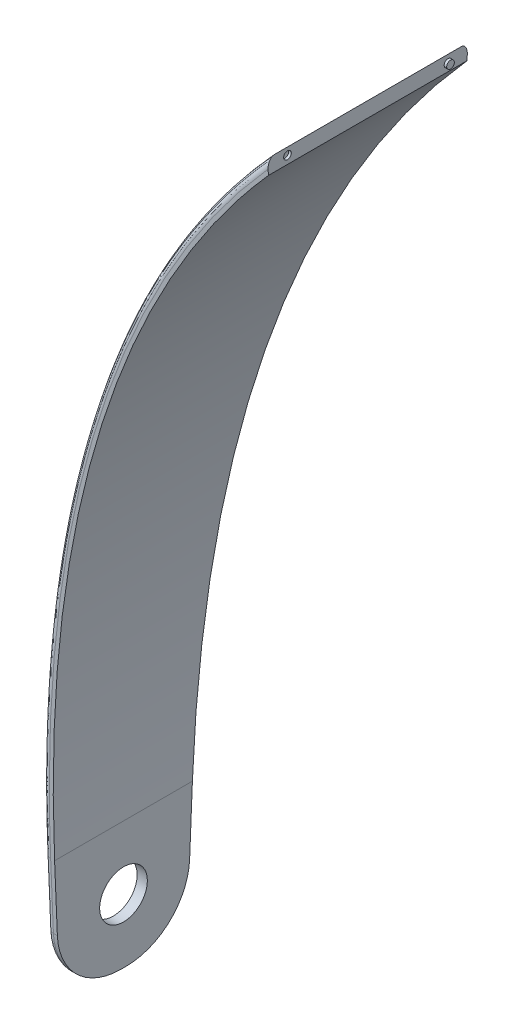
from build123d import *

# Parameters (mm, degrees)
BOSS_EXTRUDE1_DEPTH            = 22.225
CUT_EXTRUDE1_REACH             = 331.298
SKETCH2_R                      = 4.7625
CUT_EXTRUDE1_DIRECTION_2_REACH = 331.298
CUT_EXTRUDE2_DEPTH             = 254
FILLET1_R                      = 12.7
FILLET4_R                      = 1.2446
F_1_4_CLEARANCE_HOLE1_D        = 6.5278
F_1_4_CLEARANCE_HOLE1_DEPTH    = 6.35
F_1_4_CLEARANCE_HOLE1_TIP      = 1.961148974
SKETCH8_W                      = 63.920753762
SKETCH8_H                      = 259.326964074
CUT_EXTRUDE6_DEPTH             = 480.06
SKETCH11_W                     = 69.041661627
SKETCH11_H                     = 278.286213366
CUT_EXTRUDE8_DEPTH             = 480.06
SKETCH12_R                     = 0.762
BOSS_EXTRUDE2_DEPTH            = 0.508
SKETCH13_R                     = 0.762
CUT_EXTRUDE9_DEPTH             = 0.508


with BuildPart() as part:
    # Sketch1 → Boss-Extrude1 (new, symmetric)
    with BuildSketch(Plane.XY):
        with BuildLine():
            add(Edge.make_bspline(
                [(247.65, 12.7), (247.65, 151.138652105), (159.851901214, 215.9), (69.85, 215.9)],
                knots=[0, 0, 0, 0, 1, 1, 1, 1], degree=3))
            Line((69.85, 215.9), (-69.85, 215.9))
            add(Edge.make_bspline(
                [(-69.85, 215.9), (-159.851901214, 215.9), (-247.65, 151.138652105), (-247.65, 12.7)],
                knots=[0, 0, 0, 0, 1, 1, 1, 1], degree=3))
            Line((-247.65, 12.7), (-247.65, -12.7))
            Line((-247.65, -12.7), (-245.618, -12.7))
            Line((-245.618, -12.7), (-245.618, 12.7))
            add(Edge.make_bspline(
                [(-69.85, 213.868), (-75.40386678, 213.868), (-86.529134162, 213.367524052), (-108.503296863, 210.348405687), (-135.224023579, 202.760511588), (-165.078062417, 187.457160851), (-187.304904565, 169.454437631), (-203.008125467, 151.842675097), (-213.624406237, 137.012147223), (-222.956422719, 120.542434531), (-230.879834274, 102.41559311), (-237.26896978, 82.613605898), (-241.209008074, 64.702111997), (-243.466672055, 49.517673174), (-244.696729955, 37.702743517), (-245.322441099, 27.489835839), (-245.575395866, 19.120958406), (-245.618, 14.831688899), (-245.618, 12.7)],
                knots=[0, 0, 0, 0, 0.0625, 0.125, 0.25, 0.375, 0.5, 0.5625, 0.625, 0.6875, 0.75, 0.8125, 0.875, 0.90625, 0.9375, 0.96875, 0.984375, 1, 1, 1, 1], degree=3))
            Line((-69.85, 213.868), (69.85, 213.868))
            add(Edge.make_bspline(
                [(245.618, 12.7), (245.618, 14.831688899), (245.575395866, 19.120958406), (245.322441099, 27.489835839), (244.696729955, 37.702743517), (243.466672055, 49.517673174), (241.209008074, 64.702111997), (237.26896978, 82.613605898), (230.879834274, 102.41559311), (222.956422719, 120.542434531), (213.624406237, 137.012147223), (203.008125467, 151.842675097), (187.304904565, 169.454437631), (165.078062417, 187.457160851), (135.224023579, 202.760511588), (108.503296863, 210.348405687), (86.529134162, 213.367524052), (75.40386678, 213.868), (69.85, 213.868)],
                knots=[0, 0, 0, 0, 0.015625, 0.03125, 0.0625, 0.09375, 0.125, 0.1875, 0.25, 0.3125, 0.375, 0.4375, 0.5, 0.625, 0.75, 0.875, 0.9375, 1, 1, 1, 1], degree=3))
            Line((245.618, 12.7), (245.618, -12.7))
            Line((245.618, -12.7), (247.65, -12.7))
            Line((247.65, -12.7), (247.65, 12.7))
        make_face()
    extrude(amount=BOSS_EXTRUDE1_DEPTH, both=True)

    # Sketch2 → Cut-Extrude1 (cut, up to next)
    with BuildSketch(Plane(origin=(0, 0, 0), x_dir=(0, 0, -1), z_dir=(1, 0, 0)), mode=Mode.PRIVATE) as cut_extrude1_sk1:
        Circle(SKETCH2_R)
    cut_extrude1_tool1 = extrude(cut_extrude1_sk1.sketch, amount=-CUT_EXTRUDE1_REACH, mode=Mode.PRIVATE) & part.part
    add(cut_extrude1_tool1.solids().sort_by_distance((0, 0, 0))[0], mode=Mode.SUBTRACT)

    # Sketch2 → Cut-Extrude1 direction 2 (cut, up to next)
    with BuildSketch(Plane(origin=(0, 0, 0), x_dir=(0, 0, -1), z_dir=(1, 0, 0)), mode=Mode.PRIVATE) as cut_extrude1_direction_2_sk1:
        Circle(SKETCH2_R)
    cut_extrude1_direction_2_tool1 = extrude(cut_extrude1_direction_2_sk1.sketch, amount=CUT_EXTRUDE1_DIRECTION_2_REACH, mode=Mode.PRIVATE) & part.part
    add(cut_extrude1_direction_2_tool1.solids().sort_by_distance((0, 0, 0))[0], mode=Mode.SUBTRACT)

    # Sketch3 → Cut-Extrude2 (cut, symmetric)
    with BuildSketch(Plane(origin=(0, 0, 0), x_dir=(0, 0, -1), z_dir=(1, 0, 0))):
        Polygon((-22.225, 215.9), (-12.7, -12.7), (-47.625, -12.7), (-47.625, 215.9), align=None)
        Polygon((22.225, 215.9), (12.7, -12.7), (47.625, -12.7), (47.625, 215.9), align=None)
    extrude(amount=CUT_EXTRUDE2_DEPTH, both=True, mode=Mode.SUBTRACT)

    # Fillet1
    fillet1_edges = [part.edges().sort_by_distance(p)[0] for p in [
        (-246.634, -12.7, -12.7),
        (-246.634, -12.7, 12.7),
        (246.634, -12.7, -12.7),
        (246.634, -12.7, 12.7),
    ]]
    fillet(fillet1_edges, radius=FILLET1_R)

    # Fillet4
    fillet4_edges = [part.edges().sort_by_distance(p)[0] for p in [
        (247.65, -9.165276607, -9.309489742),
        (247.65, 6.085646041, -13.482735252),
        (-247.65, -9.165276607, -9.309489742),
        (-247.65, 6.085646041, -13.482735252),
        (247.65, -9.165276607, 9.309489742),
        (247.65, 6.085646041, 13.482735252),
        (-247.65, -9.165276607, 9.309489742),
        (-247.65, 6.085646041, 13.482735252),
        (0, 215.9, 22.225),
        (-203.084938623, 154.469294773, 19.665387282),
        (-247.65, -12.7, 0),
        (-203.084938623, 154.469294773, -19.665387282),
        (0, 215.9, -22.225),
        (203.084938625, 154.469294774, -19.665387282),
        (247.65, -12.7, 0),
        (203.084938625, 154.469294774, 19.665387282),
    ]]
    fillet(fillet4_edges, radius=FILLET4_R)

    # 1/4 Clearance Hole1
    with Locations(Plane(origin=(5.734151724, 215.9, -6.658847299), x_dir=(1, 0, 0), z_dir=(0, 1, 0))):
        with Locations((35.540848276, -16.183847299), (35.540848276, 2.866152701), (-47.009151724, -16.183847299), (-47.009151724, 2.866152701)):
            Hole(F_1_4_CLEARANCE_HOLE1_D / 2, depth=F_1_4_CLEARANCE_HOLE1_DEPTH)
            with Locations((0, 0, -(F_1_4_CLEARANCE_HOLE1_DEPTH + F_1_4_CLEARANCE_HOLE1_TIP / 2))):  # 118° drill point
                Cone(0, F_1_4_CLEARANCE_HOLE1_D / 2, F_1_4_CLEARANCE_HOLE1_TIP, mode=Mode.SUBTRACT)

    # Sketch8 → Cut-Extrude6 (cut)
    with BuildSketch(Plane.ZY.offset(-196.85)):
        with Locations((0.135769602, 94.203521296)):
            Rectangle(SKETCH8_W, SKETCH8_H)
    extrude(amount=-CUT_EXTRUDE6_DEPTH, mode=Mode.SUBTRACT)

    # Sketch11 → Cut-Extrude8 (cut)
    with BuildSketch(Plane.ZY.offset(196.85)):
        with Locations((3.644033196, 86.264048918)):
            Rectangle(SKETCH11_W, SKETCH11_H)
    extrude(amount=-CUT_EXTRUDE8_DEPTH, mode=Mode.SUBTRACT)

    # Sketch12 → Boss-Extrude2 (add)
    with BuildSketch(Plane(origin=(-196.85, 0, 0), x_dir=(0, 0, -1), z_dir=(1, 0, 0))):
        with Locations((16.028769638, 160.132431528)):
            Circle(SKETCH12_R)
    extrude(amount=BOSS_EXTRUDE2_DEPTH)

    # Sketch13 → Cut-Extrude9 (cut)
    with BuildSketch(Plane(origin=(-196.85, 0, 0), x_dir=(0, 0, -1), z_dir=(1, 0, 0))):
        with Locations((-16.028769638, 160.215203583)):
            Circle(SKETCH13_R)
    extrude(amount=-CUT_EXTRUDE9_DEPTH, mode=Mode.SUBTRACT)


solid = part.part
